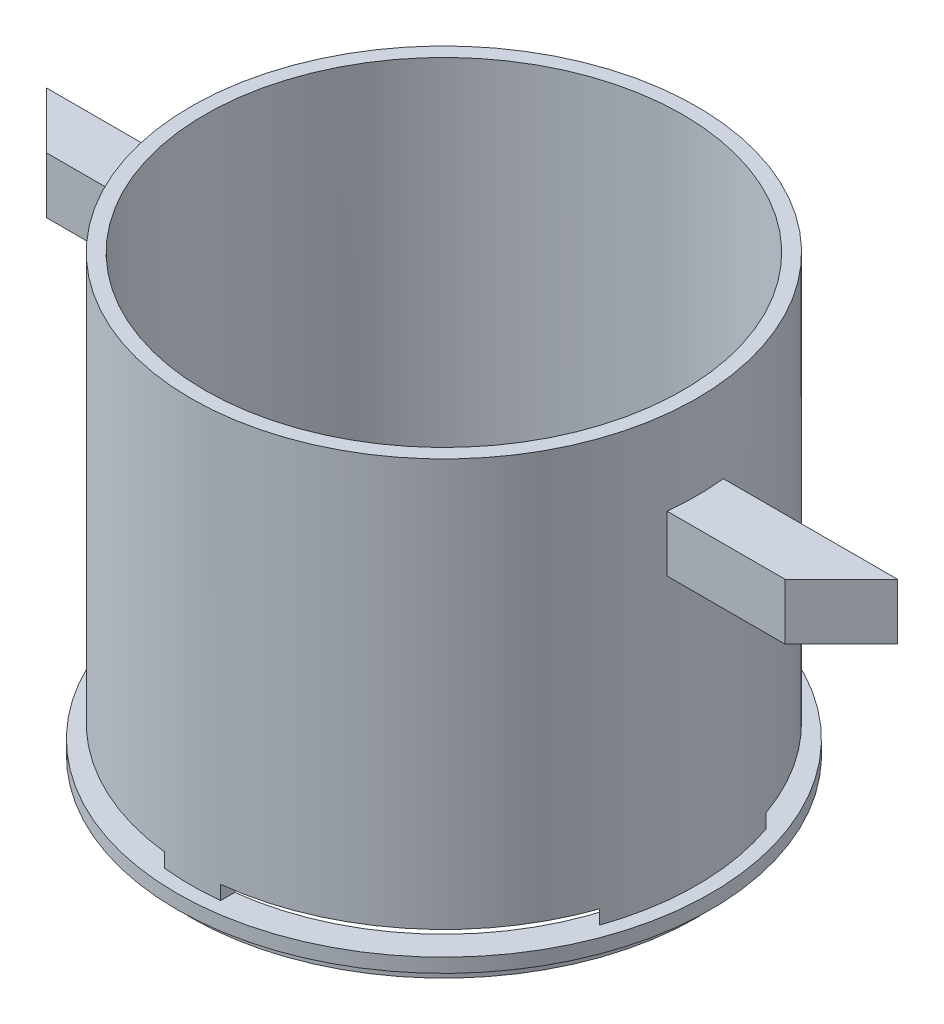
from build123d import *

# Parameters (mm, degrees)
SKETCH1_R               = 57.15
BOSS_EXTRUDE1_DEPTH     = 101.6
SKETCH2_R               = 53.975
CUT_EXTRUDE1_DEPTH      = 130.826056707
CUT_EXTRUDE4_DEPTH      = 130.826056707
CUT_EXTRUDE4_DEPTH_BACK = 130.826056707
SKETCH6_W               = 47.625
SKETCH6_H               = 3.175
BOSS_EXTRUDE6_START     = 12.7
BOSS_EXTRUDE6_DEPTH     = 12.7
BOSS_EXTRUDE7_START     = 3.175
SKETCH10_R              = 60.325
SKETCH10_R_2            = 57.15
BOSS_EXTRUDE7_DEPTH     = 3.175


with BuildPart() as part:
    # Sketch1 → Boss-Extrude1 (new body)
    with BuildSketch(Plane(origin=(0, 0, 0), x_dir=(1, 0, 0), z_dir=(0, 1, 0))):
        Circle(SKETCH1_R)
    extrude(amount=BOSS_EXTRUDE1_DEPTH)

    # Sketch2 → Cut-Extrude1 (cut, through all)
    with BuildSketch(Plane(origin=(0, 101.6, 0), x_dir=(1, 0, 0), z_dir=(0, 1, 0))):
        Circle(SKETCH2_R)
    extrude(amount=-CUT_EXTRUDE1_DEPTH, mode=Mode.SUBTRACT)

    # Sketch6 → Cut-Extrude4 (cut, two sides: drawn at the far end of the back side and taken through both)
    with BuildSketch(Plane.XY.offset(-CUT_EXTRUDE4_DEPTH_BACK)):
        with Locations((-30.1625, 7.9375)):
            Rectangle(SKETCH6_W, SKETCH6_H)
        with Locations((30.1625, 7.9375)):
            Rectangle(SKETCH6_W, SKETCH6_H)
    extrude(amount=CUT_EXTRUDE4_DEPTH + CUT_EXTRUDE4_DEPTH_BACK, mode=Mode.SUBTRACT)

    # Sketch9 → Boss-Extrude6 (add)
    with BuildSketch(Plane(origin=(0, 69.85, 0), x_dir=(1, 0, 0), z_dir=(0, 1, 0)).offset(BOSS_EXTRUDE6_START)):
        with BuildLine():
            Line((96.1525636, 6.35), (83.4525636, -6.35))
            Line((83.4525636, -6.35), (53.600169076, -6.35))
            ThreePointArc((53.600169076, -6.35), (53.975, 0), (53.600169076, 6.35))
            Line((53.600169076, 6.35), (96.1525636, 6.35))
        make_face()
        with BuildLine():
            Line((-83.4525636, -6.35), (-53.600169076, -6.35))
            ThreePointArc((-53.600169076, -6.35), (-53.975, 0), (-53.600169076, 6.35))
            Line((-53.600169076, 6.35), (-96.1525636, 6.35))
            Line((-96.1525636, 6.35), (-83.4525636, -6.35))
        make_face()
    extrude(amount=-BOSS_EXTRUDE6_DEPTH)

    # Sketch10 → Boss-Extrude7 (add)
    with BuildSketch(Plane(origin=(0, 0, 0), x_dir=(1, 0, 0), z_dir=(0, 1, 0)).offset(BOSS_EXTRUDE7_START)):
        Circle(SKETCH10_R)
        Circle(SKETCH10_R_2, mode=Mode.SUBTRACT)
    extrude(amount=BOSS_EXTRUDE7_DEPTH)


solid = part.part
